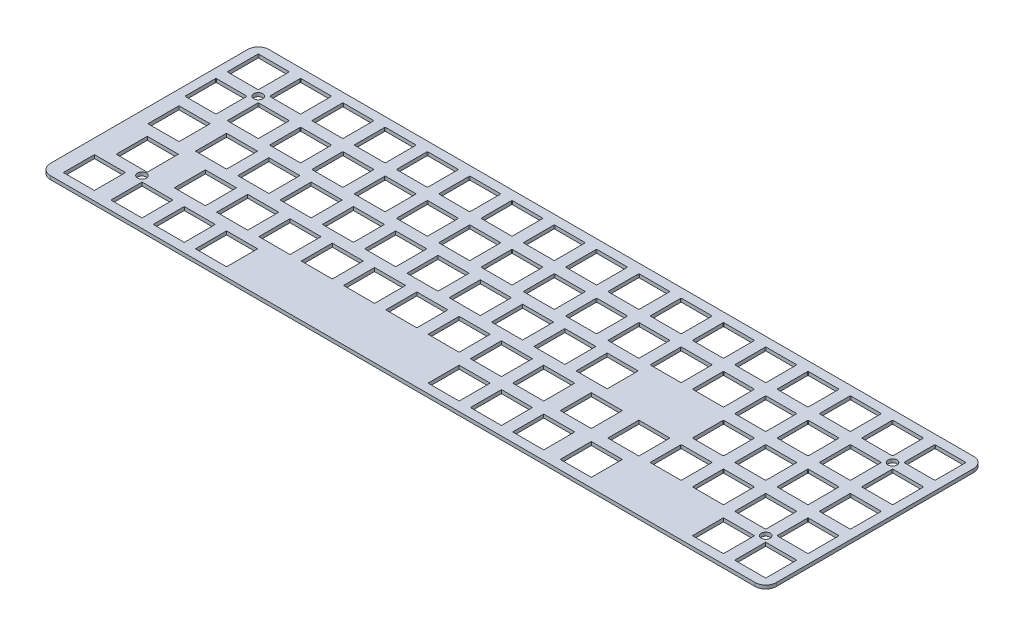
from build123d import *

# Parameters (mm, degrees)
SKETCH2_R           = 2
SKETCH2_W           = 13.9954
SKETCH2_H           = 13.9954
BOSS_EXTRUDE1_DEPTH = 0.79375


with BuildPart() as part:
    # Sketch2 → Boss-Extrude1 (new, symmetric)
    with BuildSketch(Plane(origin=(0, 0, 0), x_dir=(1, 0, 0), z_dir=(0, 1, 0))):
        with BuildLine():
            Line((158.75, -49.2125), (-158.75, -49.2125))
            ThreePointArc((-158.75, -49.2125), (-162.117596045, -47.817596045), (-163.5125, -44.45))
            Line((-163.5125, -44.45), (-163.5125, 44.45))
            ThreePointArc((-163.5125, 44.45), (-162.117596045, 47.817596045), (-158.75, 49.2125))
            Line((-158.75, 49.2125), (158.75, 49.2125))
            ThreePointArc((158.75, 49.2125), (162.117596045, 47.817596045), (163.5125, 44.45))
            Line((163.5125, 44.45), (163.5125, -44.45))
            ThreePointArc((163.5125, -44.45), (162.117596045, -47.817596045), (158.75, -49.2125))
        make_face()
        with Locations((-142.875, 28.575)):
            Circle(SKETCH2_R, mode=Mode.SUBTRACT)
        with Locations((-138.1125, -28.575)):
            Circle(SKETCH2_R, mode=Mode.SUBTRACT)
        with Locations((142.875, 28.575)):
            Circle(SKETCH2_R, mode=Mode.SUBTRACT)
        with Locations((142.875, -28.575)):
            Circle(SKETCH2_R, mode=Mode.SUBTRACT)
        with BuildLine():
            Line((-145.7071, 45.0977), (-159.0929, 45.0977))
            ThreePointArc((-159.0929, 45.0977), (-159.308426147, 45.008426147), (-159.3977, 44.7929))
            Line((-159.3977, 44.7929), (-159.3977, 31.4071))
            ThreePointArc((-159.3977, 31.4071), (-159.308426147, 31.191573853), (-159.0929, 31.1023))
            Line((-159.0929, 31.1023), (-145.7071, 31.1023))
            ThreePointArc((-145.7071, 31.1023), (-145.491573853, 31.191573853), (-145.4023, 31.4071))
            Line((-145.4023, 31.4071), (-145.4023, 44.7929))
            ThreePointArc((-145.4023, 44.7929), (-145.491573853, 45.008426147), (-145.7071, 45.0977))
        make_face(mode=Mode.SUBTRACT)
        with BuildLine():
            Line((-126.6571, 45.0977), (-140.0429, 45.0977))
            ThreePointArc((-140.0429, 45.0977), (-140.258426147, 45.008426147), (-140.3477, 44.7929))
            Line((-140.3477, 44.7929), (-140.3477, 31.4071))
            ThreePointArc((-140.3477, 31.4071), (-140.258426147, 31.191573853), (-140.0429, 31.1023))
            Line((-140.0429, 31.1023), (-126.6571, 31.1023))
            ThreePointArc((-126.6571, 31.1023), (-126.441573853, 31.191573853), (-126.3523, 31.4071))
            Line((-126.3523, 31.4071), (-126.3523, 44.7929))
            ThreePointArc((-126.3523, 44.7929), (-126.441573853, 45.008426147), (-126.6571, 45.0977))
        make_face(mode=Mode.SUBTRACT)
        with BuildLine():
            Line((-107.6071, 45.0977), (-120.9929, 45.0977))
            ThreePointArc((-120.9929, 45.0977), (-121.208426147, 45.008426147), (-121.2977, 44.7929))
            Line((-121.2977, 44.7929), (-121.2977, 31.4071))
            ThreePointArc((-121.2977, 31.4071), (-121.208426147, 31.191573853), (-120.9929, 31.1023))
            Line((-120.9929, 31.1023), (-107.6071, 31.1023))
            ThreePointArc((-107.6071, 31.1023), (-107.391573853, 31.191573853), (-107.3023, 31.4071))
            Line((-107.3023, 31.4071), (-107.3023, 44.7929))
            ThreePointArc((-107.3023, 44.7929), (-107.391573853, 45.008426147), (-107.6071, 45.0977))
        make_face(mode=Mode.SUBTRACT)
        with BuildLine():
            Line((-88.5571, 45.0977), (-101.9429, 45.0977))
            ThreePointArc((-101.9429, 45.0977), (-102.158426147, 45.008426147), (-102.2477, 44.7929))
            Line((-102.2477, 44.7929), (-102.2477, 31.4071))
            ThreePointArc((-102.2477, 31.4071), (-102.158426147, 31.191573853), (-101.9429, 31.1023))
            Line((-101.9429, 31.1023), (-88.5571, 31.1023))
            ThreePointArc((-88.5571, 31.1023), (-88.341573853, 31.191573853), (-88.2523, 31.4071))
            Line((-88.2523, 31.4071), (-88.2523, 44.7929))
            ThreePointArc((-88.2523, 44.7929), (-88.341573853, 45.008426147), (-88.5571, 45.0977))
        make_face(mode=Mode.SUBTRACT)
        with BuildLine():
            Line((-69.5071, 45.0977), (-82.8929, 45.0977))
            ThreePointArc((-82.8929, 45.0977), (-83.108426147, 45.008426147), (-83.1977, 44.7929))
            Line((-83.1977, 44.7929), (-83.1977, 31.4071))
            ThreePointArc((-83.1977, 31.4071), (-83.108426147, 31.191573853), (-82.8929, 31.1023))
            Line((-82.8929, 31.1023), (-69.5071, 31.1023))
            ThreePointArc((-69.5071, 31.1023), (-69.291573853, 31.191573853), (-69.2023, 31.4071))
            Line((-69.2023, 31.4071), (-69.2023, 44.7929))
            ThreePointArc((-69.2023, 44.7929), (-69.291573853, 45.008426147), (-69.5071, 45.0977))
        make_face(mode=Mode.SUBTRACT)
        with BuildLine():
            Line((-50.4571, 45.0977), (-63.8429, 45.0977))
            ThreePointArc((-63.8429, 45.0977), (-64.058426147, 45.008426147), (-64.1477, 44.7929))
            Line((-64.1477, 44.7929), (-64.1477, 31.4071))
            ThreePointArc((-64.1477, 31.4071), (-64.058426147, 31.191573853), (-63.8429, 31.1023))
            Line((-63.8429, 31.1023), (-50.4571, 31.1023))
            ThreePointArc((-50.4571, 31.1023), (-50.241573853, 31.191573853), (-50.1523, 31.4071))
            Line((-50.1523, 31.4071), (-50.1523, 44.7929))
            ThreePointArc((-50.1523, 44.7929), (-50.241573853, 45.008426147), (-50.4571, 45.0977))
        make_face(mode=Mode.SUBTRACT)
        with BuildLine():
            Line((-31.4071, 45.0977), (-44.7929, 45.0977))
            ThreePointArc((-44.7929, 45.0977), (-45.008426147, 45.008426147), (-45.0977, 44.7929))
            Line((-45.0977, 44.7929), (-45.0977, 31.4071))
            ThreePointArc((-45.0977, 31.4071), (-45.008426147, 31.191573853), (-44.7929, 31.1023))
            Line((-44.7929, 31.1023), (-31.4071, 31.1023))
            ThreePointArc((-31.4071, 31.1023), (-31.191573853, 31.191573853), (-31.1023, 31.4071))
            Line((-31.1023, 31.4071), (-31.1023, 44.7929))
            ThreePointArc((-31.1023, 44.7929), (-31.191573853, 45.008426147), (-31.4071, 45.0977))
        make_face(mode=Mode.SUBTRACT)
        with BuildLine():
            Line((-12.3571, 45.0977), (-25.7429, 45.0977))
            ThreePointArc((-25.7429, 45.0977), (-25.958426147, 45.008426147), (-26.0477, 44.7929))
            Line((-26.0477, 44.7929), (-26.0477, 31.4071))
            ThreePointArc((-26.0477, 31.4071), (-25.958426147, 31.191573853), (-25.7429, 31.1023))
            Line((-25.7429, 31.1023), (-12.3571, 31.1023))
            ThreePointArc((-12.3571, 31.1023), (-12.141573853, 31.191573853), (-12.0523, 31.4071))
            Line((-12.0523, 31.4071), (-12.0523, 44.7929))
            ThreePointArc((-12.0523, 44.7929), (-12.141573853, 45.008426147), (-12.3571, 45.0977))
        make_face(mode=Mode.SUBTRACT)
        with BuildLine():
            Line((6.6929, 45.0977), (-6.6929, 45.0977))
            ThreePointArc((-6.6929, 45.0977), (-6.908426147, 45.008426147), (-6.9977, 44.7929))
            Line((-6.9977, 44.7929), (-6.9977, 31.4071))
            ThreePointArc((-6.9977, 31.4071), (-6.908426147, 31.191573853), (-6.6929, 31.1023))
            Line((-6.6929, 31.1023), (6.6929, 31.1023))
            ThreePointArc((6.6929, 31.1023), (6.908426147, 31.191573853), (6.9977, 31.4071))
            Line((6.9977, 31.4071), (6.9977, 44.7929))
            ThreePointArc((6.9977, 44.7929), (6.908426147, 45.008426147), (6.6929, 45.0977))
        make_face(mode=Mode.SUBTRACT)
        with BuildLine():
            Line((25.7429, 45.0977), (12.3571, 45.0977))
            ThreePointArc((12.3571, 45.0977), (12.141573853, 45.008426147), (12.0523, 44.7929))
            Line((12.0523, 44.7929), (12.0523, 31.4071))
            ThreePointArc((12.0523, 31.4071), (12.141573853, 31.191573853), (12.3571, 31.1023))
            Line((12.3571, 31.1023), (25.7429, 31.1023))
            ThreePointArc((25.7429, 31.1023), (25.958426147, 31.191573853), (26.0477, 31.4071))
            Line((26.0477, 31.4071), (26.0477, 44.7929))
            ThreePointArc((26.0477, 44.7929), (25.958426147, 45.008426147), (25.7429, 45.0977))
        make_face(mode=Mode.SUBTRACT)
        with BuildLine():
            Line((44.7929, 45.0977), (31.4071, 45.0977))
            ThreePointArc((31.4071, 45.0977), (31.191573853, 45.008426147), (31.1023, 44.7929))
            Line((31.1023, 44.7929), (31.1023, 31.4071))
            ThreePointArc((31.1023, 31.4071), (31.191573853, 31.191573853), (31.4071, 31.1023))
            Line((31.4071, 31.1023), (44.7929, 31.1023))
            ThreePointArc((44.7929, 31.1023), (45.008426147, 31.191573853), (45.0977, 31.4071))
            Line((45.0977, 31.4071), (45.0977, 44.7929))
            ThreePointArc((45.0977, 44.7929), (45.008426147, 45.008426147), (44.7929, 45.0977))
        make_face(mode=Mode.SUBTRACT)
        with BuildLine():
            Line((63.8429, 45.0977), (50.4571, 45.0977))
            ThreePointArc((50.4571, 45.0977), (50.241573853, 45.008426147), (50.1523, 44.7929))
            Line((50.1523, 44.7929), (50.1523, 31.4071))
            ThreePointArc((50.1523, 31.4071), (50.241573853, 31.191573853), (50.4571, 31.1023))
            Line((50.4571, 31.1023), (63.8429, 31.1023))
            ThreePointArc((63.8429, 31.1023), (64.058426147, 31.191573853), (64.1477, 31.4071))
            Line((64.1477, 31.4071), (64.1477, 44.7929))
            ThreePointArc((64.1477, 44.7929), (64.058426147, 45.008426147), (63.8429, 45.0977))
        make_face(mode=Mode.SUBTRACT)
        with BuildLine():
            Line((82.8929, 45.0977), (69.5071, 45.0977))
            ThreePointArc((69.5071, 45.0977), (69.291573853, 45.008426147), (69.2023, 44.7929))
            Line((69.2023, 44.7929), (69.2023, 31.4071))
            ThreePointArc((69.2023, 31.4071), (69.291573853, 31.191573853), (69.5071, 31.1023))
            Line((69.5071, 31.1023), (82.8929, 31.1023))
            ThreePointArc((82.8929, 31.1023), (83.108426147, 31.191573853), (83.1977, 31.4071))
            Line((83.1977, 31.4071), (83.1977, 44.7929))
            ThreePointArc((83.1977, 44.7929), (83.108426147, 45.008426147), (82.8929, 45.0977))
        make_face(mode=Mode.SUBTRACT)
        with BuildLine():
            Line((101.9429, 45.0977), (88.5571, 45.0977))
            ThreePointArc((88.5571, 45.0977), (88.341573853, 45.008426147), (88.2523, 44.7929))
            Line((88.2523, 44.7929), (88.2523, 31.4071))
            ThreePointArc((88.2523, 31.4071), (88.341573853, 31.191573853), (88.5571, 31.1023))
            Line((88.5571, 31.1023), (101.9429, 31.1023))
            ThreePointArc((101.9429, 31.1023), (102.158426147, 31.191573853), (102.2477, 31.4071))
            Line((102.2477, 31.4071), (102.2477, 44.7929))
            ThreePointArc((102.2477, 44.7929), (102.158426147, 45.008426147), (101.9429, 45.0977))
        make_face(mode=Mode.SUBTRACT)
        with BuildLine():
            Line((120.9929, 45.0977), (107.6071, 45.0977))
            ThreePointArc((107.6071, 45.0977), (107.391573853, 45.008426147), (107.3023, 44.7929))
            Line((107.3023, 44.7929), (107.3023, 31.4071))
            ThreePointArc((107.3023, 31.4071), (107.391573853, 31.191573853), (107.6071, 31.1023))
            Line((107.6071, 31.1023), (120.9929, 31.1023))
            ThreePointArc((120.9929, 31.1023), (121.208426147, 31.191573853), (121.2977, 31.4071))
            Line((121.2977, 31.4071), (121.2977, 44.7929))
            ThreePointArc((121.2977, 44.7929), (121.208426147, 45.008426147), (120.9929, 45.0977))
        make_face(mode=Mode.SUBTRACT)
        with BuildLine():
            Line((140.0429, 45.0977), (126.6571, 45.0977))
            ThreePointArc((126.6571, 45.0977), (126.441573853, 45.008426147), (126.3523, 44.7929))
            Line((126.3523, 44.7929), (126.3523, 31.4071))
            ThreePointArc((126.3523, 31.4071), (126.441573853, 31.191573853), (126.6571, 31.1023))
            Line((126.6571, 31.1023), (140.0429, 31.1023))
            ThreePointArc((140.0429, 31.1023), (140.258426147, 31.191573853), (140.3477, 31.4071))
            Line((140.3477, 31.4071), (140.3477, 44.7929))
            ThreePointArc((140.3477, 44.7929), (140.258426147, 45.008426147), (140.0429, 45.0977))
        make_face(mode=Mode.SUBTRACT)
        with BuildLine():
            Line((159.0929, 45.0977), (145.7071, 45.0977))
            ThreePointArc((145.7071, 45.0977), (145.491573853, 45.008426147), (145.4023, 44.7929))
            Line((145.4023, 44.7929), (145.4023, 31.4071))
            ThreePointArc((145.4023, 31.4071), (145.491573853, 31.191573853), (145.7071, 31.1023))
            Line((145.7071, 31.1023), (159.0929, 31.1023))
            ThreePointArc((159.0929, 31.1023), (159.308426147, 31.191573853), (159.3977, 31.4071))
            Line((159.3977, 31.4071), (159.3977, 44.7929))
            ThreePointArc((159.3977, 44.7929), (159.308426147, 45.008426147), (159.0929, 45.0977))
        make_face(mode=Mode.SUBTRACT)
        with BuildLine():
            Line((-126.6571, 26.0477), (-140.0429, 26.0477))
            ThreePointArc((-140.0429, 26.0477), (-140.258426147, 25.958426147), (-140.3477, 25.7429))
            Line((-140.3477, 25.7429), (-140.3477, 12.3571))
            ThreePointArc((-140.3477, 12.3571), (-140.258426147, 12.141573853), (-140.0429, 12.0523))
            Line((-140.0429, 12.0523), (-126.6571, 12.0523))
            ThreePointArc((-126.6571, 12.0523), (-126.441573853, 12.141573853), (-126.3523, 12.3571))
            Line((-126.3523, 12.3571), (-126.3523, 25.7429))
            ThreePointArc((-126.3523, 25.7429), (-126.441573853, 25.958426147), (-126.6571, 26.0477))
        make_face(mode=Mode.SUBTRACT)
        with BuildLine():
            Line((-107.6071, 26.0477), (-120.9929, 26.0477))
            ThreePointArc((-120.9929, 26.0477), (-121.208426147, 25.958426147), (-121.2977, 25.7429))
            Line((-121.2977, 25.7429), (-121.2977, 12.3571))
            ThreePointArc((-121.2977, 12.3571), (-121.208426147, 12.141573853), (-120.9929, 12.0523))
            Line((-120.9929, 12.0523), (-107.6071, 12.0523))
            ThreePointArc((-107.6071, 12.0523), (-107.391573853, 12.141573853), (-107.3023, 12.3571))
            Line((-107.3023, 12.3571), (-107.3023, 25.7429))
            ThreePointArc((-107.3023, 25.7429), (-107.391573853, 25.958426147), (-107.6071, 26.0477))
        make_face(mode=Mode.SUBTRACT)
        with BuildLine():
            Line((-88.5571, 26.0477), (-101.9429, 26.0477))
            ThreePointArc((-101.9429, 26.0477), (-102.158426147, 25.958426147), (-102.2477, 25.7429))
            Line((-102.2477, 25.7429), (-102.2477, 12.3571))
            ThreePointArc((-102.2477, 12.3571), (-102.158426147, 12.141573853), (-101.9429, 12.0523))
            Line((-101.9429, 12.0523), (-88.5571, 12.0523))
            ThreePointArc((-88.5571, 12.0523), (-88.341573853, 12.141573853), (-88.2523, 12.3571))
            Line((-88.2523, 12.3571), (-88.2523, 25.7429))
            ThreePointArc((-88.2523, 25.7429), (-88.341573853, 25.958426147), (-88.5571, 26.0477))
        make_face(mode=Mode.SUBTRACT)
        with BuildLine():
            Line((-69.5071, 26.0477), (-82.8929, 26.0477))
            ThreePointArc((-82.8929, 26.0477), (-83.108426147, 25.958426147), (-83.1977, 25.7429))
            Line((-83.1977, 25.7429), (-83.1977, 12.3571))
            ThreePointArc((-83.1977, 12.3571), (-83.108426147, 12.141573853), (-82.8929, 12.0523))
            Line((-82.8929, 12.0523), (-69.5071, 12.0523))
            ThreePointArc((-69.5071, 12.0523), (-69.291573853, 12.141573853), (-69.2023, 12.3571))
            Line((-69.2023, 12.3571), (-69.2023, 25.7429))
            ThreePointArc((-69.2023, 25.7429), (-69.291573853, 25.958426147), (-69.5071, 26.0477))
        make_face(mode=Mode.SUBTRACT)
        with BuildLine():
            Line((-50.4571, 26.0477), (-63.8429, 26.0477))
            ThreePointArc((-63.8429, 26.0477), (-64.058426147, 25.958426147), (-64.1477, 25.7429))
            Line((-64.1477, 25.7429), (-64.1477, 12.3571))
            ThreePointArc((-64.1477, 12.3571), (-64.058426147, 12.141573853), (-63.8429, 12.0523))
            Line((-63.8429, 12.0523), (-50.4571, 12.0523))
            ThreePointArc((-50.4571, 12.0523), (-50.241573853, 12.141573853), (-50.1523, 12.3571))
            Line((-50.1523, 12.3571), (-50.1523, 25.7429))
            ThreePointArc((-50.1523, 25.7429), (-50.241573853, 25.958426147), (-50.4571, 26.0477))
        make_face(mode=Mode.SUBTRACT)
        with BuildLine():
            Line((-31.4071, 26.0477), (-44.7929, 26.0477))
            ThreePointArc((-44.7929, 26.0477), (-45.008426147, 25.958426147), (-45.0977, 25.7429))
            Line((-45.0977, 25.7429), (-45.0977, 12.3571))
            ThreePointArc((-45.0977, 12.3571), (-45.008426147, 12.141573853), (-44.7929, 12.0523))
            Line((-44.7929, 12.0523), (-31.4071, 12.0523))
            ThreePointArc((-31.4071, 12.0523), (-31.191573853, 12.141573853), (-31.1023, 12.3571))
            Line((-31.1023, 12.3571), (-31.1023, 25.7429))
            ThreePointArc((-31.1023, 25.7429), (-31.191573853, 25.958426147), (-31.4071, 26.0477))
        make_face(mode=Mode.SUBTRACT)
        with BuildLine():
            Line((-12.3571, 26.0477), (-25.7429, 26.0477))
            ThreePointArc((-25.7429, 26.0477), (-25.958426147, 25.958426147), (-26.0477, 25.7429))
            Line((-26.0477, 25.7429), (-26.0477, 12.3571))
            ThreePointArc((-26.0477, 12.3571), (-25.958426147, 12.141573853), (-25.7429, 12.0523))
            Line((-25.7429, 12.0523), (-12.3571, 12.0523))
            ThreePointArc((-12.3571, 12.0523), (-12.141573853, 12.141573853), (-12.0523, 12.3571))
            Line((-12.0523, 12.3571), (-12.0523, 25.7429))
            ThreePointArc((-12.0523, 25.7429), (-12.141573853, 25.958426147), (-12.3571, 26.0477))
        make_face(mode=Mode.SUBTRACT)
        with BuildLine():
            Line((6.6929, 26.0477), (-6.6929, 26.0477))
            ThreePointArc((-6.6929, 26.0477), (-6.908426147, 25.958426147), (-6.9977, 25.7429))
            Line((-6.9977, 25.7429), (-6.9977, 12.3571))
            ThreePointArc((-6.9977, 12.3571), (-6.908426147, 12.141573853), (-6.6929, 12.0523))
            Line((-6.6929, 12.0523), (6.6929, 12.0523))
            ThreePointArc((6.6929, 12.0523), (6.908426147, 12.141573853), (6.9977, 12.3571))
            Line((6.9977, 12.3571), (6.9977, 25.7429))
            ThreePointArc((6.9977, 25.7429), (6.908426147, 25.958426147), (6.6929, 26.0477))
        make_face(mode=Mode.SUBTRACT)
        with BuildLine():
            Line((25.7429, 26.0477), (12.3571, 26.0477))
            ThreePointArc((12.3571, 26.0477), (12.141573853, 25.958426147), (12.0523, 25.7429))
            Line((12.0523, 25.7429), (12.0523, 12.3571))
            ThreePointArc((12.0523, 12.3571), (12.141573853, 12.141573853), (12.3571, 12.0523))
            Line((12.3571, 12.0523), (25.7429, 12.0523))
            ThreePointArc((25.7429, 12.0523), (25.958426147, 12.141573853), (26.0477, 12.3571))
            Line((26.0477, 12.3571), (26.0477, 25.7429))
            ThreePointArc((26.0477, 25.7429), (25.958426147, 25.958426147), (25.7429, 26.0477))
        make_face(mode=Mode.SUBTRACT)
        with BuildLine():
            Line((44.7929, 26.0477), (31.4071, 26.0477))
            ThreePointArc((31.4071, 26.0477), (31.191573853, 25.958426147), (31.1023, 25.7429))
            Line((31.1023, 25.7429), (31.1023, 12.3571))
            ThreePointArc((31.1023, 12.3571), (31.191573853, 12.141573853), (31.4071, 12.0523))
            Line((31.4071, 12.0523), (44.7929, 12.0523))
            ThreePointArc((44.7929, 12.0523), (45.008426147, 12.141573853), (45.0977, 12.3571))
            Line((45.0977, 12.3571), (45.0977, 25.7429))
            ThreePointArc((45.0977, 25.7429), (45.008426147, 25.958426147), (44.7929, 26.0477))
        make_face(mode=Mode.SUBTRACT)
        with BuildLine():
            Line((63.8429, 26.0477), (50.4571, 26.0477))
            ThreePointArc((50.4571, 26.0477), (50.241573853, 25.958426147), (50.1523, 25.7429))
            Line((50.1523, 25.7429), (50.1523, 12.3571))
            ThreePointArc((50.1523, 12.3571), (50.241573853, 12.141573853), (50.4571, 12.0523))
            Line((50.4571, 12.0523), (63.8429, 12.0523))
            ThreePointArc((63.8429, 12.0523), (64.058426147, 12.141573853), (64.1477, 12.3571))
            Line((64.1477, 12.3571), (64.1477, 25.7429))
            ThreePointArc((64.1477, 25.7429), (64.058426147, 25.958426147), (63.8429, 26.0477))
        make_face(mode=Mode.SUBTRACT)
        with BuildLine():
            Line((82.8929, 26.0477), (69.5071, 26.0477))
            ThreePointArc((69.5071, 26.0477), (69.291573853, 25.958426147), (69.2023, 25.7429))
            Line((69.2023, 25.7429), (69.2023, 12.3571))
            ThreePointArc((69.2023, 12.3571), (69.291573853, 12.141573853), (69.5071, 12.0523))
            Line((69.5071, 12.0523), (82.8929, 12.0523))
            ThreePointArc((82.8929, 12.0523), (83.108426147, 12.141573853), (83.1977, 12.3571))
            Line((83.1977, 12.3571), (83.1977, 25.7429))
            ThreePointArc((83.1977, 25.7429), (83.108426147, 25.958426147), (82.8929, 26.0477))
        make_face(mode=Mode.SUBTRACT)
        with BuildLine():
            Line((101.9429, 26.0477), (88.5571, 26.0477))
            ThreePointArc((88.5571, 26.0477), (88.341573853, 25.958426147), (88.2523, 25.7429))
            Line((88.2523, 25.7429), (88.2523, 12.3571))
            ThreePointArc((88.2523, 12.3571), (88.341573853, 12.141573853), (88.5571, 12.0523))
            Line((88.5571, 12.0523), (101.9429, 12.0523))
            ThreePointArc((101.9429, 12.0523), (102.158426147, 12.141573853), (102.2477, 12.3571))
            Line((102.2477, 12.3571), (102.2477, 25.7429))
            ThreePointArc((102.2477, 25.7429), (102.158426147, 25.958426147), (101.9429, 26.0477))
        make_face(mode=Mode.SUBTRACT)
        with BuildLine():
            Line((120.9929, 26.0477), (107.6071, 26.0477))
            ThreePointArc((107.6071, 26.0477), (107.391573853, 25.958426147), (107.3023, 25.7429))
            Line((107.3023, 25.7429), (107.3023, 12.3571))
            ThreePointArc((107.3023, 12.3571), (107.391573853, 12.141573853), (107.6071, 12.0523))
            Line((107.6071, 12.0523), (120.9929, 12.0523))
            ThreePointArc((120.9929, 12.0523), (121.208426147, 12.141573853), (121.2977, 12.3571))
            Line((121.2977, 12.3571), (121.2977, 25.7429))
            ThreePointArc((121.2977, 25.7429), (121.208426147, 25.958426147), (120.9929, 26.0477))
        make_face(mode=Mode.SUBTRACT)
        with BuildLine():
            Line((140.0429, 26.0477), (126.6571, 26.0477))
            ThreePointArc((126.6571, 26.0477), (126.441573853, 25.958426147), (126.3523, 25.7429))
            Line((126.3523, 25.7429), (126.3523, 12.3571))
            ThreePointArc((126.3523, 12.3571), (126.441573853, 12.141573853), (126.6571, 12.0523))
            Line((126.6571, 12.0523), (140.0429, 12.0523))
            ThreePointArc((140.0429, 12.0523), (140.258426147, 12.141573853), (140.3477, 12.3571))
            Line((140.3477, 12.3571), (140.3477, 25.7429))
            ThreePointArc((140.3477, 25.7429), (140.258426147, 25.958426147), (140.0429, 26.0477))
        make_face(mode=Mode.SUBTRACT)
        with BuildLine():
            Line((159.0929, 26.0477), (145.7071, 26.0477))
            ThreePointArc((145.7071, 26.0477), (145.491573853, 25.958426147), (145.4023, 25.7429))
            Line((145.4023, 25.7429), (145.4023, 12.3571))
            ThreePointArc((145.4023, 12.3571), (145.491573853, 12.141573853), (145.7071, 12.0523))
            Line((145.7071, 12.0523), (159.0929, 12.0523))
            ThreePointArc((159.0929, 12.0523), (159.308426147, 12.141573853), (159.3977, 12.3571))
            Line((159.3977, 12.3571), (159.3977, 25.7429))
            ThreePointArc((159.3977, 25.7429), (159.308426147, 25.958426147), (159.0929, 26.0477))
        make_face(mode=Mode.SUBTRACT)
        with BuildLine():
            Line((-145.7071, 26.0477), (-159.0929, 26.0477))
            ThreePointArc((-159.0929, 26.0477), (-159.308426147, 25.958426147), (-159.3977, 25.7429))
            Line((-159.3977, 25.7429), (-159.3977, 12.3571))
            ThreePointArc((-159.3977, 12.3571), (-159.308426147, 12.141573853), (-159.0929, 12.0523))
            Line((-159.0929, 12.0523), (-145.7071, 12.0523))
            ThreePointArc((-145.7071, 12.0523), (-145.491573853, 12.141573853), (-145.4023, 12.3571))
            Line((-145.4023, 12.3571), (-145.4023, 25.7429))
            ThreePointArc((-145.4023, 25.7429), (-145.491573853, 25.958426147), (-145.7071, 26.0477))
        make_face(mode=Mode.SUBTRACT)
        with Locations((-150.01875, 0)):
            Rectangle(SKETCH2_W, SKETCH2_H, mode=Mode.SUBTRACT)
        with Locations((-145.25625, -19.05)):
            Rectangle(SKETCH2_W, SKETCH2_H, mode=Mode.SUBTRACT)
        with Locations((-150.01875, -38.1)):
            Rectangle(SKETCH2_W, SKETCH2_H, mode=Mode.SUBTRACT)
        with Locations((-128.5875, 0)):
            Rectangle(SKETCH2_W, SKETCH2_H, mode=Mode.SUBTRACT)
        with Locations((-119.0625, -19.05)):
            Rectangle(SKETCH2_W, SKETCH2_H, mode=Mode.SUBTRACT)
        with Locations((-128.5875, -38.1)):
            Rectangle(SKETCH2_W, SKETCH2_H, mode=Mode.SUBTRACT)
        with Locations((-109.5375, 0)):
            Rectangle(SKETCH2_W, SKETCH2_H, mode=Mode.SUBTRACT)
        with Locations((-90.4875, 0)):
            Rectangle(SKETCH2_W, SKETCH2_H, mode=Mode.SUBTRACT)
        with Locations((-71.4375, 0)):
            Rectangle(SKETCH2_W, SKETCH2_H, mode=Mode.SUBTRACT)
        with Locations((-52.3875, 0)):
            Rectangle(SKETCH2_W, SKETCH2_H, mode=Mode.SUBTRACT)
        with Locations((-33.3375, 0)):
            Rectangle(SKETCH2_W, SKETCH2_H, mode=Mode.SUBTRACT)
        with Locations((-14.2875, 0)):
            Rectangle(SKETCH2_W, SKETCH2_H, mode=Mode.SUBTRACT)
        with Locations((4.7625, 0)):
            Rectangle(SKETCH2_W, SKETCH2_H, mode=Mode.SUBTRACT)
        with Locations((23.8125, 0)):
            Rectangle(SKETCH2_W, SKETCH2_H, mode=Mode.SUBTRACT)
        with Locations((42.8625, 0)):
            Rectangle(SKETCH2_W, SKETCH2_H, mode=Mode.SUBTRACT)
        with Locations((-100.0125, -19.05)):
            Rectangle(SKETCH2_W, SKETCH2_H, mode=Mode.SUBTRACT)
        with Locations((-80.9625, -19.05)):
            Rectangle(SKETCH2_W, SKETCH2_H, mode=Mode.SUBTRACT)
        with Locations((-61.9125, -19.05)):
            Rectangle(SKETCH2_W, SKETCH2_H, mode=Mode.SUBTRACT)
        with Locations((-42.8625, -19.05)):
            Rectangle(SKETCH2_W, SKETCH2_H, mode=Mode.SUBTRACT)
        with Locations((-23.8125, -19.05)):
            Rectangle(SKETCH2_W, SKETCH2_H, mode=Mode.SUBTRACT)
        with Locations((-4.7625, -19.05)):
            Rectangle(SKETCH2_W, SKETCH2_H, mode=Mode.SUBTRACT)
        with Locations((14.2875, -19.05)):
            Rectangle(SKETCH2_W, SKETCH2_H, mode=Mode.SUBTRACT)
        with Locations((33.3375, -19.05)):
            Rectangle(SKETCH2_W, SKETCH2_H, mode=Mode.SUBTRACT)
        with Locations((-109.5375, -38.1)):
            Rectangle(SKETCH2_W, SKETCH2_H, mode=Mode.SUBTRACT)
        with Locations((-90.4875, -38.1)):
            Rectangle(SKETCH2_W, SKETCH2_H, mode=Mode.SUBTRACT)
        with BuildLine():
            Line((101.9429, -6.9977), (88.5571, -6.9977))
            ThreePointArc((88.5571, -6.9977), (88.341573853, -6.908426147), (88.2523, -6.6929))
            Line((88.2523, -6.6929), (88.2523, 6.6929))
            ThreePointArc((88.2523, 6.6929), (88.341573853, 6.908426147), (88.5571, 6.9977))
            Line((88.5571, 6.9977), (101.9429, 6.9977))
            ThreePointArc((101.9429, 6.9977), (102.158426147, 6.908426147), (102.2477, 6.6929))
            Line((102.2477, 6.6929), (102.2477, -6.6929))
            ThreePointArc((102.2477, -6.6929), (102.158426147, -6.908426147), (101.9429, -6.9977))
        make_face(mode=Mode.SUBTRACT)
        with Locations((14.2875, -38.1)):
            Rectangle(SKETCH2_W, SKETCH2_H, mode=Mode.SUBTRACT)
        with Locations((33.3375, -38.1)):
            Rectangle(SKETCH2_W, SKETCH2_H, mode=Mode.SUBTRACT)
        with Locations((52.3875, -38.1)):
            Rectangle(SKETCH2_W, SKETCH2_H, mode=Mode.SUBTRACT)
        with Locations((73.81875, -38.1)):
            Rectangle(SKETCH2_W, SKETCH2_H, mode=Mode.SUBTRACT)
        with BuildLine():
            Line((120.9929, -6.9977), (107.6071, -6.9977))
            ThreePointArc((107.6071, -6.9977), (107.391573853, -6.908426147), (107.3023, -6.6929))
            Line((107.3023, -6.6929), (107.3023, 6.6929))
            ThreePointArc((107.3023, 6.6929), (107.391573853, 6.908426147), (107.6071, 6.9977))
            Line((107.6071, 6.9977), (120.9929, 6.9977))
            ThreePointArc((120.9929, 6.9977), (121.208426147, 6.908426147), (121.2977, 6.6929))
            Line((121.2977, 6.6929), (121.2977, -6.6929))
            ThreePointArc((121.2977, -6.6929), (121.208426147, -6.908426147), (120.9929, -6.9977))
        make_face(mode=Mode.SUBTRACT)
        with BuildLine():
            Line((140.0429, 6.9977), (126.6571, 6.9977))
            ThreePointArc((126.6571, 6.9977), (126.441573853, 6.908426147), (126.3523, 6.6929))
            Line((126.3523, 6.6929), (126.3523, -6.6929))
            ThreePointArc((126.3523, -6.6929), (126.441573853, -6.908426147), (126.6571, -6.9977))
            Line((126.6571, -6.9977), (140.0429, -6.9977))
            ThreePointArc((140.0429, -6.9977), (140.258426147, -6.908426147), (140.3477, -6.6929))
            Line((140.3477, -6.6929), (140.3477, 6.6929))
            ThreePointArc((140.3477, 6.6929), (140.258426147, 6.908426147), (140.0429, 6.9977))
        make_face(mode=Mode.SUBTRACT)
        with BuildLine():
            Line((159.3977, 6.6929), (159.3977, -6.6929))
            ThreePointArc((159.3977, -6.6929), (159.308426147, -6.908426147), (159.0929, -6.9977))
            Line((159.0929, -6.9977), (145.7071, -6.9977))
            ThreePointArc((145.7071, -6.9977), (145.491573853, -6.908426147), (145.4023, -6.6929))
            Line((145.4023, -6.6929), (145.4023, 6.6929))
            ThreePointArc((145.4023, 6.6929), (145.491573853, 6.908426147), (145.7071, 6.9977))
            Line((145.7071, 6.9977), (159.0929, 6.9977))
            ThreePointArc((159.0929, 6.9977), (159.308426147, 6.908426147), (159.3977, 6.6929))
        make_face(mode=Mode.SUBTRACT)
        with BuildLine():
            Line((101.9429, -26.0477), (88.5571, -26.0477))
            ThreePointArc((88.5571, -26.0477), (88.341573853, -25.958426147), (88.2523, -25.7429))
            Line((88.2523, -25.7429), (88.2523, -12.3571))
            ThreePointArc((88.2523, -12.3571), (88.341573853, -12.141573853), (88.5571, -12.0523))
            Line((88.5571, -12.0523), (101.9429, -12.0523))
            ThreePointArc((101.9429, -12.0523), (102.158426147, -12.141573853), (102.2477, -12.3571))
            Line((102.2477, -12.3571), (102.2477, -25.7429))
            ThreePointArc((102.2477, -25.7429), (102.158426147, -25.958426147), (101.9429, -26.0477))
        make_face(mode=Mode.SUBTRACT)
        with BuildLine():
            Line((120.9929, -26.0477), (107.6071, -26.0477))
            ThreePointArc((107.6071, -26.0477), (107.391573853, -25.958426147), (107.3023, -25.7429))
            Line((107.3023, -25.7429), (107.3023, -12.3571))
            ThreePointArc((107.3023, -12.3571), (107.391573853, -12.141573853), (107.6071, -12.0523))
            Line((107.6071, -12.0523), (120.9929, -12.0523))
            ThreePointArc((120.9929, -12.0523), (121.208426147, -12.141573853), (121.2977, -12.3571))
            Line((121.2977, -12.3571), (121.2977, -25.7429))
            ThreePointArc((121.2977, -25.7429), (121.208426147, -25.958426147), (120.9929, -26.0477))
        make_face(mode=Mode.SUBTRACT)
        with BuildLine():
            Line((140.0429, -12.0523), (126.6571, -12.0523))
            ThreePointArc((126.6571, -12.0523), (126.441573853, -12.141573853), (126.3523, -12.3571))
            Line((126.3523, -12.3571), (126.3523, -25.7429))
            ThreePointArc((126.3523, -25.7429), (126.441573853, -25.958426147), (126.6571, -26.0477))
            Line((126.6571, -26.0477), (140.0429, -26.0477))
            ThreePointArc((140.0429, -26.0477), (140.258426147, -25.958426147), (140.3477, -25.7429))
            Line((140.3477, -25.7429), (140.3477, -12.3571))
            ThreePointArc((140.3477, -12.3571), (140.258426147, -12.141573853), (140.0429, -12.0523))
        make_face(mode=Mode.SUBTRACT)
        with BuildLine():
            Line((159.3977, -12.3571), (159.3977, -25.7429))
            ThreePointArc((159.3977, -25.7429), (159.308426147, -25.958426147), (159.0929, -26.0477))
            Line((159.0929, -26.0477), (145.7071, -26.0477))
            ThreePointArc((145.7071, -26.0477), (145.491573853, -25.958426147), (145.4023, -25.7429))
            Line((145.4023, -25.7429), (145.4023, -12.3571))
            ThreePointArc((145.4023, -12.3571), (145.491573853, -12.141573853), (145.7071, -12.0523))
            Line((145.7071, -12.0523), (159.0929, -12.0523))
            ThreePointArc((159.0929, -12.0523), (159.308426147, -12.141573853), (159.3977, -12.3571))
        make_face(mode=Mode.SUBTRACT)
        with Locations((152.4, -38.1)):
            Rectangle(SKETCH2_W, SKETCH2_H, mode=Mode.SUBTRACT)
        with Locations((133.35, -38.1)):
            Rectangle(SKETCH2_W, SKETCH2_H, mode=Mode.SUBTRACT)
        with Locations((76.2, -19.05)):
            Rectangle(SKETCH2_W, SKETCH2_H, mode=Mode.SUBTRACT)
        with Locations((54.76875, -19.05)):
            Rectangle(SKETCH2_W, SKETCH2_H, mode=Mode.SUBTRACT)
    extrude(amount=BOSS_EXTRUDE1_DEPTH, both=True)


solid = part.part
